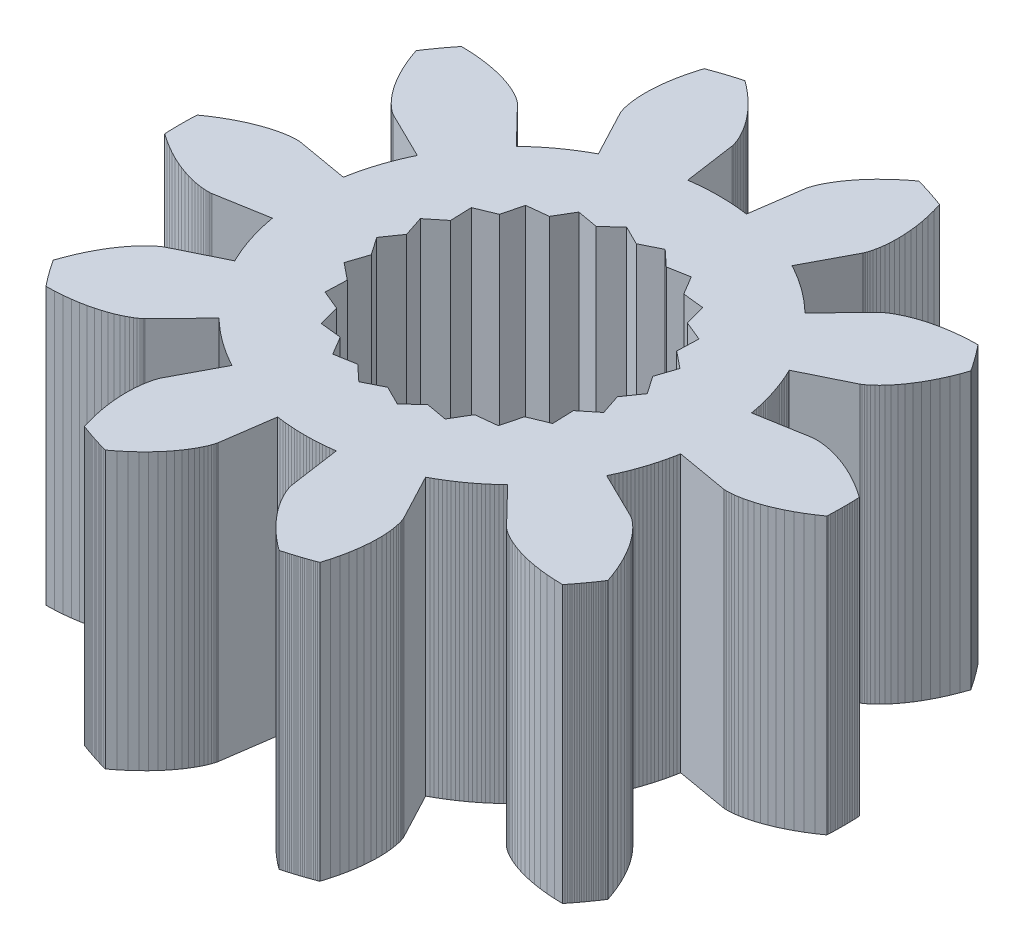
from build123d import *

# Parameters (mm, degrees)
BOSS_EXTRUDE1_DEPTH = 5
SKETCH2_R           = 1.5
CUT_EXTRUDE1_DEPTH  = 10.722497268
CUT_EXTRUDE2_DEPTH  = 10.722497268


with BuildPart() as part:
    # Sketch1 → Boss-Extrude1 (new body)
    with BuildSketch(Plane(origin=(0, 0, 0), x_dir=(1, 0, 0), z_dir=(0, 1, 0))):
        Polygon((3.6946769, -0.6417654), (4.6291475, -0.8040829), (4.6332094, -0.8046724), (4.6454524, -0.8059869), (4.6659298, -0.8073423), (4.6946521, -0.8080515), (4.7315867, -0.8074275), (4.7766581, -0.8047855), (4.8297479, -0.7994452), (4.8906949, -0.7907331), (4.9592959, -0.7779854), (5.035306, -0.7605497), (5.1184393, -0.7377878), (5.2083696, -0.7090775), (5.3047313, -0.6738155), (5.4071205, -0.631419), (5.515096, -0.5813282), (5.6281806, -0.523008), (5.7458624, -0.4559506), (5.8675963, -0.379677), (5.9928055, -0.2937389), (5.9942402, -0.26284), (5.9955155, -0.2319341), (5.9966316, -0.201022), (5.9975882, -0.1701046), (5.9983855, -0.1391826), (5.9990233, -0.108257), (5.9995017, -0.0773285), (5.9998206, -0.0463979), (5.9999801, -0.0154661), (5.9999801, 0.0154661), (5.9998206, 0.0463979), (5.9995017, 0.0773285), (5.9990233, 0.108257), (5.9983855, 0.1391826), (5.9975882, 0.1701046), (5.9966316, 0.201022), (5.9955155, 0.2319341), (5.9942402, 0.26284), (5.9928055, 0.2937389), (5.8675963, 0.379677), (5.7458624, 0.4559506), (5.6281806, 0.523008), (5.515096, 0.5813282), (5.4071205, 0.631419), (5.3047313, 0.6738155), (5.2083696, 0.7090775), (5.1184393, 0.7377878), (5.035306, 0.7605497), (4.9592959, 0.7779854), (4.8906949, 0.7907331), (4.8297479, 0.7994452), (4.7766581, 0.8047855), (4.7315867, 0.8074275), (4.6946521, 0.8080515), (4.6659298, 0.8073423), (4.6454524, 0.8059869), (4.6332094, 0.8046724), (4.6291475, 0.8040829), (3.6946769, 0.6417654), (3.6846589, 0.6969853), (3.6738157, 0.7520491), (3.6621497, 0.8069445), (3.6496635, 0.8616591), (3.6363598, 0.9161808), (3.6222417, 0.9704972), (3.6073123, 1.0245963), (3.591575, 1.078466), (3.5750333, 1.132094), (3.5576909, 1.1854685), (3.5395516, 1.2385775), (3.5206196, 1.2914091), (3.5008991, 1.3439515), (3.4803944, 1.3961929), (3.4591103, 1.4481215), (3.4370514, 1.4997258), (3.4142227, 1.5509942), (3.3906294, 1.6019152), (3.3662766, 1.6524775), (4.217687, 2.0704279), (4.2213197, 2.0723385), (4.2319972, 2.0784713), (4.2493604, 2.0894111), (4.2730141, 2.1057199), (4.3025281, 2.1279343), (4.3374387, 2.156564), (4.3772502, 2.1920898), (4.4214365, 2.2349618), (4.469443, 2.2855975), (4.520688, 2.3443809), (4.5745651, 2.4116603), (4.6304448, 2.4877471), (4.6876766, 2.5729146), (4.7455911, 2.6673969), (4.8035025, 2.7713877), (4.8607101, 2.8850392), (4.9165014, 3.0084614), (4.9701537, 3.1417214), (5.0209369, 3.2848429), (5.0039356, 3.3106839), (4.9868014, 3.336437), (4.9695346, 3.3621014), (4.9521358, 3.3876764), (4.9346053, 3.4131614), (4.9169437, 3.4385557), (4.8991514, 3.4638585), (4.8812288, 3.4890694), (4.8631766, 3.5141875), (4.8449951, 3.5392121), (4.8266848, 3.5641428), (4.8082463, 3.5889787), (4.7896799, 3.6137192), (4.7709863, 3.6383636), (4.7521658, 3.6629114), (4.7332191, 3.6873618), (4.7141465, 3.7117142), (4.6949487, 3.735968), (4.6756261, 3.7601225), (4.5238166, 3.7560517), (4.3804993, 3.746205), (4.2458773, 3.7312839), (4.1201102, 3.7119964), (4.0033136, 3.6890544), (3.8955589, 3.663171), (3.7968742, 3.6350586), (3.7072436, 3.605426), (3.6266082, 3.5749763), (3.5548663, 3.5444044), (3.491874, 3.5143949), (3.437446, 3.4856193), (3.3913565, 3.4587344), (3.3533401, 3.4343795), (3.3230926, 3.4131746), (3.3002726, 3.3957183), (3.2845027, 3.3825855), (3.2753706, 3.3743258), (3.2724309, 3.3714613), (2.6118362, 2.6908757), (2.571274, 2.7296611), (2.530136, 2.7678352), (2.4884313, 2.8053894), (2.4461693, 2.8423152), (2.4033593, 2.8786045), (2.3600111, 2.914249), (2.3161344, 2.9492408), (2.2717388, 2.9835721), (2.2268345, 3.0172352), (2.1814314, 3.0502224), (2.1355398, 3.0825265), (2.0891698, 3.1141402), (2.042332, 3.1450565), (1.9950367, 3.1752683), (1.9472946, 3.2047689), (1.8991163, 3.2335518), (1.8505127, 3.2616105), (1.8014946, 3.2889386), (1.7520731, 3.3155301), (2.1952135, 4.1541056), (2.1970294, 4.1577866), (2.2020629, 4.1690241), (2.2096797, 4.1880805), (2.2192299, 4.2151778), (2.2300499, 4.2504976), (2.2414651, 4.2941794), (2.2527917, 4.346321), (2.2633397, 4.4069772), (2.2724148, 4.4761599), (2.2793209, 4.5538378), (2.2833626, 4.6399361), (2.2838475, 4.7343368), (2.2800888, 4.8368788), (2.2714073, 4.9473579), (2.2571343, 5.0655277), (2.2366136, 5.1910994), (2.2092039, 5.3237434), (2.1742812, 5.463089), (2.1312411, 5.6087264), (2.1022978, 5.6196391), (2.0732986, 5.6304025), (2.0442444, 5.6410163), (2.0151358, 5.6514801), (1.9859736, 5.6617938), (1.9567587, 5.6719569), (1.9274917, 5.6819693), (1.8981736, 5.6918307), (1.868805, 5.7015408), (1.8393867, 5.7110994), (1.8099195, 5.7205062), (1.7804042, 5.729761), (1.7508416, 5.7388634), (1.7212325, 5.7478134), (1.6915776, 5.7566106), (1.6618778, 5.7652547), (1.6321338, 5.7737457), (1.6023464, 5.7820832), (1.5725164, 5.790267), (1.4520927, 5.6977423), (1.3419343, 5.6055363), (1.2417933, 5.5143362), (1.1513824, 5.4248082), (1.0703769, 5.3375964), (0.9984155, 5.2533197), (0.9351019, 5.1725708), (0.8800069, 5.095914), (0.8326693, 5.0238834), (0.7925986, 4.9569814), (0.7592759, 4.8956772), (0.7321566, 4.8404053), (0.710672, 4.7915643), (0.6942315, 4.7495152), (0.6822246, 4.7145811), (0.6740235, 4.6870454), (0.6689846, 4.6671514), (0.6664515, 4.6551015), (0.6657569, 4.6510561), (0.5313628, 3.7121629), (0.4757498, 3.7196992), (0.4200303, 3.7264024), (0.3642167, 3.7322709), (0.3083215, 3.7373036), (0.2523573, 3.7414991), (0.1963365, 3.7448567), (0.1402718, 3.7473756), (0.0841756, 3.7490551), (0.0280606, 3.749895), (-0.0280606, 3.749895), (-0.0841756, 3.7490551), (-0.1402718, 3.7473756), (-0.1963365, 3.7448567), (-0.2523573, 3.7414991), (-0.3083215, 3.7373036), (-0.3642167, 3.7322709), (-0.4200303, 3.7264024), (-0.4757498, 3.7196992), (-0.5313628, 3.7121629), (-0.6657569, 4.6510561), (-0.6664515, 4.6551015), (-0.6689846, 4.6671514), (-0.6740235, 4.6870454), (-0.6822246, 4.7145811), (-0.6942315, 4.7495152), (-0.710672, 4.7915643), (-0.7321566, 4.8404053), (-0.7592759, 4.8956772), (-0.7925986, 4.9569814), (-0.8326693, 5.0238834), (-0.8800069, 5.095914), (-0.9351019, 5.1725708), (-0.9984155, 5.2533197), (-1.0703769, 5.3375964), (-1.1513824, 5.4248082), (-1.2417933, 5.5143362), (-1.3419343, 5.6055363), (-1.4520927, 5.6977423), (-1.5725164, 5.790267), (-1.6023464, 5.7820832), (-1.6321338, 5.7737457), (-1.6618778, 5.7652547), (-1.6915776, 5.7566106), (-1.7212325, 5.7478134), (-1.7508416, 5.7388634), (-1.7804042, 5.729761), (-1.8099195, 5.7205062), (-1.8393867, 5.7110994), (-1.868805, 5.7015408), (-1.8981736, 5.6918307), (-1.9274917, 5.6819693), (-1.9567587, 5.6719569), (-1.9859736, 5.6617938), (-2.0151358, 5.6514801), (-2.0442444, 5.6410163), (-2.0732986, 5.6304025), (-2.1022978, 5.6196391), (-2.1312411, 5.6087264), (-2.1742812, 5.463089), (-2.2092039, 5.3237434), (-2.2366136, 5.1910994), (-2.2571343, 5.0655277), (-2.2714073, 4.9473579), (-2.2800888, 4.8368788), (-2.2838475, 4.7343368), (-2.2833626, 4.6399361), (-2.2793209, 4.5538378), (-2.2724148, 4.4761599), (-2.2633397, 4.4069772), (-2.2527917, 4.346321), (-2.2414651, 4.2941794), (-2.2300499, 4.2504976), (-2.2192299, 4.2151778), (-2.2096797, 4.1880805), (-2.2020629, 4.1690241), (-2.1970294, 4.1577866), (-2.1952135, 4.1541056), (-1.7520731, 3.3155301), (-1.8014946, 3.2889386), (-1.8505127, 3.2616105), (-1.8991163, 3.2335518), (-1.9472946, 3.2047689), (-1.9950367, 3.1752683), (-2.042332, 3.1450565), (-2.0891698, 3.1141402), (-2.1355398, 3.0825265), (-2.1814314, 3.0502224), (-2.2268345, 3.0172352), (-2.2717388, 2.9835721), (-2.3161344, 2.9492408), (-2.3600111, 2.914249), (-2.4033593, 2.8786045), (-2.4461693, 2.8423152), (-2.4884313, 2.8053894), (-2.530136, 2.7678352), (-2.571274, 2.7296611), (-2.6118362, 2.6908757), (-3.2724309, 3.3714613), (-3.2753706, 3.3743258), (-3.2845027, 3.3825855), (-3.3002726, 3.3957183), (-3.3230926, 3.4131746), (-3.3533401, 3.4343795), (-3.3913565, 3.4587344), (-3.437446, 3.4856193), (-3.491874, 3.5143949), (-3.5548663, 3.5444044), (-3.6266082, 3.5749763), (-3.7072436, 3.605426), (-3.7968742, 3.6350586), (-3.8955589, 3.663171), (-4.0033136, 3.6890544), (-4.1201102, 3.7119964), (-4.2458773, 3.7312839), (-4.3804993, 3.746205), (-4.5238166, 3.7560517), (-4.6756261, 3.7601225), (-4.6949487, 3.735968), (-4.7141465, 3.7117142), (-4.7332191, 3.6873618), (-4.7521658, 3.6629114), (-4.7709863, 3.6383636), (-4.7896799, 3.6137192), (-4.8082463, 3.5889787), (-4.8266848, 3.5641428), (-4.8449951, 3.5392121), (-4.8631766, 3.5141875), (-4.8812288, 3.4890694), (-4.8991514, 3.4638585), (-4.9169437, 3.4385557), (-4.9346053, 3.4131614), (-4.9521358, 3.3876764), (-4.9695346, 3.3621014), (-4.9868014, 3.336437), (-5.0039356, 3.3106839), (-5.0209369, 3.2848429), (-4.9701537, 3.1417214), (-4.9165014, 3.0084614), (-4.8607101, 2.8850392), (-4.8035025, 2.7713877), (-4.7455911, 2.6673969), (-4.6876766, 2.5729146), (-4.6304448, 2.4877471), (-4.5745651, 2.4116603), (-4.520688, 2.3443809), (-4.469443, 2.2855975), (-4.4214365, 2.2349618), (-4.3772502, 2.1920898), (-4.3374387, 2.156564), (-4.3025281, 2.1279343), (-4.2730141, 2.1057199), (-4.2493604, 2.0894111), (-4.2319972, 2.0784713), (-4.2213197, 2.0723385), (-4.217687, 2.0704279), (-3.3662766, 1.6524775), (-3.3906294, 1.6019152), (-3.4142227, 1.5509942), (-3.4370514, 1.4997258), (-3.4591103, 1.4481215), (-3.4803944, 1.3961929), (-3.5008991, 1.3439515), (-3.5206196, 1.2914091), (-3.5395516, 1.2385775), (-3.5576909, 1.1854685), (-3.5750333, 1.132094), (-3.591575, 1.078466), (-3.6073123, 1.0245963), (-3.6222417, 0.9704972), (-3.6363598, 0.9161808), (-3.6496635, 0.8616591), (-3.6621497, 0.8069445), (-3.6738157, 0.7520491), (-3.6846589, 0.6969853), (-3.6946769, 0.6417654), (-4.6291475, 0.8040829), (-4.6332094, 0.8046724), (-4.6454524, 0.8059869), (-4.6659298, 0.8073423), (-4.6946521, 0.8080515), (-4.7315867, 0.8074275), (-4.7766581, 0.8047855), (-4.8297479, 0.7994452), (-4.8906949, 0.7907331), (-4.9592959, 0.7779854), (-5.035306, 0.7605497), (-5.1184393, 0.7377878), (-5.2083696, 0.7090775), (-5.3047313, 0.6738155), (-5.4071205, 0.631419), (-5.515096, 0.5813282), (-5.6281806, 0.523008), (-5.7458624, 0.4559506), (-5.8675963, 0.379677), (-5.9928055, 0.2937389), (-5.9942402, 0.26284), (-5.9955155, 0.2319341), (-5.9966316, 0.201022), (-5.9975882, 0.1701046), (-5.9983855, 0.1391826), (-5.9990233, 0.108257), (-5.9995017, 0.0773285), (-5.9998206, 0.0463979), (-5.9999801, 0.0154661), (-5.9999801, -0.0154661), (-5.9998206, -0.0463979), (-5.9995017, -0.0773285), (-5.9990233, -0.108257), (-5.9983855, -0.1391826), (-5.9975882, -0.1701046), (-5.9966316, -0.201022), (-5.9955155, -0.2319341), (-5.9942402, -0.26284), (-5.9928055, -0.2937389), (-5.8675963, -0.379677), (-5.7458624, -0.4559506), (-5.6281806, -0.523008), (-5.515096, -0.5813282), (-5.4071205, -0.631419), (-5.3047313, -0.6738155), (-5.2083696, -0.7090775), (-5.1184393, -0.7377878), (-5.035306, -0.7605497), (-4.9592959, -0.7779854), (-4.8906949, -0.7907331), (-4.8297479, -0.7994452), (-4.7766581, -0.8047855), (-4.7315867, -0.8074275), (-4.6946521, -0.8080515), (-4.6659298, -0.8073423), (-4.6454524, -0.8059869), (-4.6332094, -0.8046724), (-4.6291475, -0.8040829), (-3.6946769, -0.6417654), (-3.6846589, -0.6969853), (-3.6738157, -0.7520491), (-3.6621497, -0.8069445), (-3.6496635, -0.8616591), (-3.6363598, -0.9161808), (-3.6222417, -0.9704972), (-3.6073123, -1.0245963), (-3.591575, -1.078466), (-3.5750333, -1.132094), (-3.5576909, -1.1854685), (-3.5395516, -1.2385775), (-3.5206196, -1.2914091), (-3.5008991, -1.3439515), (-3.4803944, -1.3961929), (-3.4591103, -1.4481215), (-3.4370514, -1.4997258), (-3.4142227, -1.5509942), (-3.3906294, -1.6019152), (-3.3662766, -1.6524775), (-4.217687, -2.0704279), (-4.2213197, -2.0723385), (-4.2319972, -2.0784713), (-4.2493604, -2.0894111), (-4.2730141, -2.1057199), (-4.3025281, -2.1279343), (-4.3374387, -2.156564), (-4.3772502, -2.1920898), (-4.4214365, -2.2349618), (-4.469443, -2.2855975), (-4.520688, -2.3443809), (-4.5745651, -2.4116603), (-4.6304448, -2.4877471), (-4.6876766, -2.5729146), (-4.7455911, -2.6673969), (-4.8035025, -2.7713877), (-4.8607101, -2.8850392), (-4.9165014, -3.0084614), (-4.9701537, -3.1417214), (-5.0209369, -3.2848429), (-5.0039356, -3.3106839), (-4.9868014, -3.336437), (-4.9695346, -3.3621014), (-4.9521358, -3.3876764), (-4.9346053, -3.4131614), (-4.9169437, -3.4385557), (-4.8991514, -3.4638585), (-4.8812288, -3.4890694), (-4.8631766, -3.5141875), (-4.8449951, -3.5392121), (-4.8266848, -3.5641428), (-4.8082463, -3.5889787), (-4.7896799, -3.6137192), (-4.7709863, -3.6383636), (-4.7521658, -3.6629114), (-4.7332191, -3.6873618), (-4.7141465, -3.7117142), (-4.6949487, -3.735968), (-4.6756261, -3.7601225), (-4.5238166, -3.7560517), (-4.3804993, -3.746205), (-4.2458773, -3.7312839), (-4.1201102, -3.7119964), (-4.0033136, -3.6890544), (-3.8955589, -3.663171), (-3.7968742, -3.6350586), (-3.7072436, -3.605426), (-3.6266082, -3.5749763), (-3.5548663, -3.5444044), (-3.491874, -3.5143949), (-3.437446, -3.4856193), (-3.3913565, -3.4587344), (-3.3533401, -3.4343795), (-3.3230926, -3.4131746), (-3.3002726, -3.3957183), (-3.2845027, -3.3825855), (-3.2753706, -3.3743258), (-3.2724309, -3.3714613), (-2.6118362, -2.6908757), (-2.571274, -2.7296611), (-2.530136, -2.7678352), (-2.4884313, -2.8053894), (-2.4461693, -2.8423152), (-2.4033593, -2.8786045), (-2.3600111, -2.914249), (-2.3161344, -2.9492408), (-2.2717388, -2.9835721), (-2.2268345, -3.0172352), (-2.1814314, -3.0502224), (-2.1355398, -3.0825265), (-2.0891698, -3.1141402), (-2.042332, -3.1450565), (-1.9950367, -3.1752683), (-1.9472946, -3.2047689), (-1.8991163, -3.2335518), (-1.8505127, -3.2616105), (-1.8014946, -3.2889386), (-1.7520731, -3.3155301), (-2.1952135, -4.1541056), (-2.1970294, -4.1577866), (-2.2020629, -4.1690241), (-2.2096797, -4.1880805), (-2.2192299, -4.2151778), (-2.2300499, -4.2504976), (-2.2414651, -4.2941794), (-2.2527917, -4.346321), (-2.2633397, -4.4069772), (-2.2724148, -4.4761599), (-2.2793209, -4.5538378), (-2.2833626, -4.6399361), (-2.2838475, -4.7343368), (-2.2800888, -4.8368788), (-2.2714073, -4.9473579), (-2.2571343, -5.0655277), (-2.2366136, -5.1910994), (-2.2092039, -5.3237434), (-2.1742812, -5.463089), (-2.1312411, -5.6087264), (-2.1022978, -5.6196391), (-2.0732986, -5.6304025), (-2.0442444, -5.6410163), (-2.0151358, -5.6514801), (-1.9859736, -5.6617938), (-1.9567587, -5.6719569), (-1.9274917, -5.6819693), (-1.8981736, -5.6918307), (-1.868805, -5.7015408), (-1.8393867, -5.7110994), (-1.8099195, -5.7205062), (-1.7804042, -5.729761), (-1.7508416, -5.7388634), (-1.7212325, -5.7478134), (-1.6915776, -5.7566106), (-1.6618778, -5.7652547), (-1.6321338, -5.7737457), (-1.6023464, -5.7820832), (-1.5725164, -5.790267), (-1.4520927, -5.6977423), (-1.3419343, -5.6055363), (-1.2417933, -5.5143362), (-1.1513824, -5.4248082), (-1.0703769, -5.3375964), (-0.9984155, -5.2533197), (-0.9351019, -5.1725708), (-0.8800069, -5.095914), (-0.8326693, -5.0238834), (-0.7925986, -4.9569814), (-0.7592759, -4.8956772), (-0.7321566, -4.8404053), (-0.710672, -4.7915643), (-0.6942315, -4.7495152), (-0.6822246, -4.7145811), (-0.6740235, -4.6870454), (-0.6689846, -4.6671514), (-0.6664515, -4.6551015), (-0.6657569, -4.6510561), (-0.5313628, -3.7121629), (-0.4757498, -3.7196992), (-0.4200303, -3.7264024), (-0.3642167, -3.7322709), (-0.3083215, -3.7373036), (-0.2523573, -3.7414991), (-0.1963365, -3.7448567), (-0.1402718, -3.7473756), (-0.0841756, -3.7490551), (-0.0280606, -3.749895), (0.0280606, -3.749895), (0.0841756, -3.7490551), (0.1402718, -3.7473756), (0.1963365, -3.7448567), (0.2523573, -3.7414991), (0.3083215, -3.7373036), (0.3642167, -3.7322709), (0.4200303, -3.7264024), (0.4757498, -3.7196992), (0.5313628, -3.7121629), (0.6657569, -4.6510561), (0.6664515, -4.6551015), (0.6689846, -4.6671514), (0.6740235, -4.6870454), (0.6822246, -4.7145811), (0.6942315, -4.7495152), (0.710672, -4.7915643), (0.7321566, -4.8404053), (0.7592759, -4.8956772), (0.7925986, -4.9569814), (0.8326693, -5.0238834), (0.8800069, -5.095914), (0.9351019, -5.1725708), (0.9984155, -5.2533197), (1.0703769, -5.3375964), (1.1513824, -5.4248082), (1.2417933, -5.5143362), (1.3419343, -5.6055363), (1.4520927, -5.6977423), (1.5725164, -5.790267), (1.6023464, -5.7820832), (1.6321338, -5.7737457), (1.6618778, -5.7652547), (1.6915776, -5.7566106), (1.7212325, -5.7478134), (1.7508416, -5.7388634), (1.7804042, -5.729761), (1.8099195, -5.7205062), (1.8393867, -5.7110994), (1.868805, -5.7015408), (1.8981736, -5.6918307), (1.9274917, -5.6819693), (1.9567587, -5.6719569), (1.9859736, -5.6617938), (2.0151358, -5.6514801), (2.0442444, -5.6410163), (2.0732986, -5.6304025), (2.1022978, -5.6196391), (2.1312411, -5.6087264), (2.1742812, -5.463089), (2.2092039, -5.3237434), (2.2366136, -5.1910994), (2.2571343, -5.0655277), (2.2714073, -4.9473579), (2.2800888, -4.8368788), (2.2838475, -4.7343368), (2.2833626, -4.6399361), (2.2793209, -4.5538378), (2.2724148, -4.4761599), (2.2633397, -4.4069772), (2.2527917, -4.346321), (2.2414651, -4.2941794), (2.2300499, -4.2504976), (2.2192299, -4.2151778), (2.2096797, -4.1880805), (2.2020629, -4.1690241), (2.1970294, -4.1577866), (2.1952135, -4.1541056), (1.7520731, -3.3155301), (1.8014946, -3.2889386), (1.8505127, -3.2616105), (1.8991163, -3.2335518), (1.9472946, -3.2047689), (1.9950367, -3.1752683), (2.042332, -3.1450565), (2.0891698, -3.1141402), (2.1355398, -3.0825265), (2.1814314, -3.0502224), (2.2268345, -3.0172352), (2.2717388, -2.9835721), (2.3161344, -2.9492408), (2.3600111, -2.914249), (2.4033593, -2.8786045), (2.4461693, -2.8423152), (2.4884313, -2.8053894), (2.530136, -2.7678352), (2.571274, -2.7296611), (2.6118362, -2.6908757), (3.2724309, -3.3714613), (3.2753706, -3.3743258), (3.2845027, -3.3825855), (3.3002726, -3.3957183), (3.3230926, -3.4131746), (3.3533401, -3.4343795), (3.3913565, -3.4587344), (3.437446, -3.4856193), (3.491874, -3.5143949), (3.5548663, -3.5444044), (3.6266082, -3.5749763), (3.7072436, -3.605426), (3.7968742, -3.6350586), (3.8955589, -3.663171), (4.0033136, -3.6890544), (4.1201102, -3.7119964), (4.2458773, -3.7312839), (4.3804993, -3.746205), (4.5238166, -3.7560517), (4.6756261, -3.7601225), (4.6949487, -3.735968), (4.7141465, -3.7117142), (4.7332191, -3.6873618), (4.7521658, -3.6629114), (4.7709863, -3.6383636), (4.7896799, -3.6137192), (4.8082463, -3.5889787), (4.8266848, -3.5641428), (4.8449951, -3.5392121), (4.8631766, -3.5141875), (4.8812288, -3.4890694), (4.8991514, -3.4638585), (4.9169437, -3.4385557), (4.9346053, -3.4131614), (4.9521358, -3.3876764), (4.9695346, -3.3621014), (4.9868014, -3.336437), (5.0039356, -3.3106839), (5.0209369, -3.2848429), (4.9701537, -3.1417214), (4.9165014, -3.0084614), (4.8607101, -2.8850392), (4.8035025, -2.7713877), (4.7455911, -2.6673969), (4.6876766, -2.5729146), (4.6304448, -2.4877471), (4.5745651, -2.4116603), (4.520688, -2.3443809), (4.469443, -2.2855975), (4.4214365, -2.2349618), (4.3772502, -2.1920898), (4.3374387, -2.156564), (4.3025281, -2.1279343), (4.2730141, -2.1057199), (4.2493604, -2.0894111), (4.2319972, -2.0784713), (4.2213197, -2.0723385), (4.217687, -2.0704279), (3.3662766, -1.6524775), (3.3906294, -1.6019152), (3.4142227, -1.5509942), (3.4370514, -1.4997258), (3.4591103, -1.4481215), (3.4803944, -1.3961929), (3.5008991, -1.3439515), (3.5206196, -1.2914091), (3.5395516, -1.2385775), (3.5576909, -1.1854685), (3.5750333, -1.132094), (3.591575, -1.078466), (3.6073123, -1.0245963), (3.6222417, -0.9704972), (3.6363598, -0.9161808), (3.6496635, -0.8616591), (3.6621497, -0.8069445), (3.6738157, -0.7520491), (3.6846589, -0.6969853), align=None)
    extrude(amount=BOSS_EXTRUDE1_DEPTH)

    # Sketch2 → Cut-Extrude1 (cut, through all)
    with BuildSketch(Plane(origin=(0, 5, 0), x_dir=(1, 0, 0), z_dir=(0, 1, 0))):
        Circle(SKETCH2_R)
    extrude(amount=-CUT_EXTRUDE1_DEPTH, mode=Mode.SUBTRACT)

    # Sketch4 → Cut-Extrude2 (cut, through all)
    with BuildSketch(Plane(origin=(0, 5, 0), x_dir=(1, 0, 0), z_dir=(0, 1, 0))):
        Polygon((-0.633898253, -2.158859191), (-0.348538872, -2.424141105), (0, -2.25), (0.348538872, -2.424141105), (0.633898253, -2.158859191), (1.017380071, -2.227751609), (1.216441839, -1.892820449), (1.603799186, -1.850882928), (1.700436542, -1.473436651), (2.06028803, -1.324066719), (2.04667199, -0.934683779), (2.34986459, -0.689982499), (2.227098244, -0.320208386), (2.449069097, 0), (2.227098244, 0.320208386), (2.34986459, 0.689982499), (2.04667199, 0.934683779), (2.06028803, 1.324066719), (1.700436542, 1.473436651), (1.603799186, 1.850882928), (1.216441839, 1.892820449), (1.017380071, 2.227751609), (0.633898253, 2.158859191), (0.348538872, 2.424141105), (0, 2.25), (-0.348538872, 2.424141105), (-0.633898253, 2.158859191), (-1.017380071, 2.227751609), (-1.216441839, 1.892820449), (-1.603799186, 1.850882928), (-1.700436542, 1.473436651), (-2.06028803, 1.324066719), (-2.04667199, 0.934683779), (-2.34986459, 0.689982499), (-2.227098244, 0.320208386), (-2.449069097, 0), (-2.227098244, -0.320208386), (-2.34986459, -0.689982499), (-2.04667199, -0.934683779), (-2.06028803, -1.324066719), (-1.700436542, -1.473436651), (-1.603799186, -1.850882928), (-1.216441839, -1.892820449), (-1.017380071, -2.227751609), align=None)
    extrude(amount=-CUT_EXTRUDE2_DEPTH, mode=Mode.SUBTRACT)


solid = part.part
